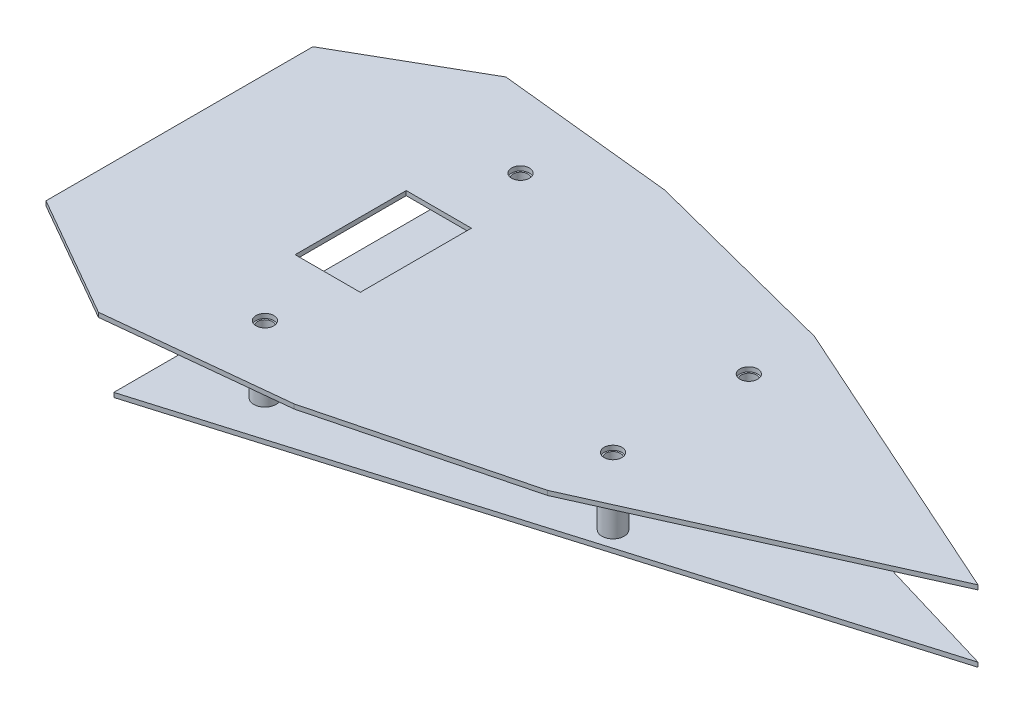
from build123d import *

# Parameters (mm, degrees)
STOCK_BODY2_2_1_START         = -47.04864598
STOCK_BODY2_2_1_OUTLINE_W     = 43.787012176
STOCK_BODY2_2_1_OUTLINE_H     = 74.629705784
STOCK_BODY2_2_1_OUTLINE_R     = 6
STOCK_BODY2_2_1_DEPTH         = 3
STOCK_BODY2_2_1_START_2       = -92.04864598
STOCK_BODY2_2_1_2_OUTLINE_R   = 6
STOCK_BODY2_2_1_2_OUTLINE_W   = 35.905709945
STOCK_BODY2_2_1_2_OUTLINE_H   = 59.945220798
STOCK_BODY2_2_1_2_DEPTH       = 3
STOCK_BODY2_2_1_START_3       = -89.04864598
STOCK_BODY2_2_1_3_OUTLINE_R   = 7.5
STOCK_BODY2_2_1_3_OUTLINE_R_2 = 5
STOCK_BODY2_2_1_3_DEPTH       = 42
SCALE1_SCALE                  = 1.5
SKETCH2_W                     = 19.240593306
SKETCH2_H                     = 84.91603611
BOSS_EXTRUDE1_DEPTH           = 38.1
SKETCH3_W                     = 30.633251364
SKETCH3_H                     = 84.659976372
BOSS_EXTRUDE2_DEPTH           = 38.1
SKETCH4_R                     = 19.304
CUT_EXTRUDE2_DEPTH            = 31.6738
SKETCH5_R                     = 24.765
CUT_EXTRUDE3_DEPTH            = 31.6738


# Read off the part's stored shape, not the designer's step: Stock-Body2.2-1
with BuildPart() as part:
    # Stock-Body2.2-1 outline → Stock-Body2.2-1 (new body)
    with BuildSketch(Plane(origin=(0, 0, 0), x_dir=(1, 0, 0), z_dir=(0, 1, 0)).offset(STOCK_BODY2_2_1_START)):
        Polygon((135.362738013, -89.648548647), (334.939803936, 0), (135.362738013, 89.648548647), (0, 124.445224737), (-119.088720056, 136.857824586), (-201.515305017, 89.648548647), (-201.515305017, -89.648548647), (-119.088720056, -136.857824586), (0, -124.445224737), align=None)
        with Locations((-64.591790786, 0)):
            Rectangle(STOCK_BODY2_2_1_OUTLINE_W, STOCK_BODY2_2_1_OUTLINE_H, mode=Mode.SUBTRACT)
        with Locations((-58.24622251, -85.855051723)):
            Circle(STOCK_BODY2_2_1_OUTLINE_R, mode=Mode.SUBTRACT)
        with Locations((135.362738013, -45.618949287)):
            Circle(STOCK_BODY2_2_1_OUTLINE_R, mode=Mode.SUBTRACT)
        with Locations((-58.24622251, 85.855051723)):
            Circle(STOCK_BODY2_2_1_OUTLINE_R, mode=Mode.SUBTRACT)
        with Locations((135.362738013, 45.618949287)):
            Circle(STOCK_BODY2_2_1_OUTLINE_R, mode=Mode.SUBTRACT)
    extrude(amount=STOCK_BODY2_2_1_DEPTH)



with BuildPart() as body_2:
    # Stock-Body2.2-1 2 outline → Stock-Body2.2-1 2 (new body)
    with BuildSketch(Plane(origin=(0, 0, 0), x_dir=(1, 0, 0), z_dir=(0, 1, 0)).offset(STOCK_BODY2_2_1_START_2)):
        Polygon((-112.290148162, -133.312365233), (334.939803936, 0), (-112.290148162, 133.312365233), align=None)
        with Locations((-58.24622251, -85.855051723)):
            Circle(STOCK_BODY2_2_1_2_OUTLINE_R, mode=Mode.SUBTRACT)
        with Locations((135.362738013, -45.618949287)):
            Circle(STOCK_BODY2_2_1_2_OUTLINE_R, mode=Mode.SUBTRACT)
        with Locations((-67.509316896, 0)):
            Rectangle(STOCK_BODY2_2_1_2_OUTLINE_W, STOCK_BODY2_2_1_2_OUTLINE_H, mode=Mode.SUBTRACT)
        with Locations((-58.24622251, 85.855051723)):
            Circle(STOCK_BODY2_2_1_2_OUTLINE_R, mode=Mode.SUBTRACT)
        with Locations((135.362738013, 45.618949287)):
            Circle(STOCK_BODY2_2_1_2_OUTLINE_R, mode=Mode.SUBTRACT)
    extrude(amount=STOCK_BODY2_2_1_2_DEPTH)


with BuildPart() as part_1:
    add(part.part)

    add(body_2.part)  # Stock-Body2.2-1 3 merges body 2
    # Stock-Body2.2-1 3 outline → Stock-Body2.2-1 3 (add)
    # profile 1 of 4: a face of its own
    with BuildSketch(Plane(origin=(0, 0, 0), x_dir=(1, 0, 0), z_dir=(0, 1, 0)).offset(STOCK_BODY2_2_1_START_3)):
        with Locations((135.362738013, -45.618949287)):
            Circle(STOCK_BODY2_2_1_3_OUTLINE_R)
        with Locations((135.362738013, -45.618949287)):
            Circle(STOCK_BODY2_2_1_3_OUTLINE_R_2, mode=Mode.SUBTRACT)
    # profile 2 of 4: a face of its own
    with BuildSketch(Plane(origin=(0, 0, 0), x_dir=(1, 0, 0), z_dir=(0, 1, 0)).offset(STOCK_BODY2_2_1_START_3)):
        with Locations((-58.24622251, 85.855051723)):
            Circle(STOCK_BODY2_2_1_3_OUTLINE_R)
        with Locations((-58.24622251, 85.855051723)):
            Circle(STOCK_BODY2_2_1_3_OUTLINE_R_2, mode=Mode.SUBTRACT)
    # profile 3 of 4: a face of its own
    with BuildSketch(Plane(origin=(0, 0, 0), x_dir=(1, 0, 0), z_dir=(0, 1, 0)).offset(STOCK_BODY2_2_1_START_3)):
        with Locations((135.362738013, 45.618949287)):
            Circle(STOCK_BODY2_2_1_3_OUTLINE_R)
        with Locations((135.362738013, 45.618949287)):
            Circle(STOCK_BODY2_2_1_3_OUTLINE_R_2, mode=Mode.SUBTRACT)
    # profile 4 of 4: a face of its own
    with BuildSketch(Plane(origin=(0, 0, 0), x_dir=(1, 0, 0), z_dir=(0, 1, 0)).offset(STOCK_BODY2_2_1_START_3)):
        with Locations((-58.24622251, -85.855051723)):
            Circle(STOCK_BODY2_2_1_3_OUTLINE_R)
        with Locations((-58.24622251, -85.855051723)):
            Circle(STOCK_BODY2_2_1_3_OUTLINE_R_2, mode=Mode.SUBTRACT)
    extrude(amount=STOCK_BODY2_2_1_3_DEPTH)


with BuildPart() as part_2:
    # Scale1: scaled about (21.693705028, -62.849152598, 0)
    add(part_1.part.scale(SCALE1_SCALE).moved(Location((-10.846852514, 31.424576299, 0))))

    # Sketch2 → Boss-Extrude1 (add)
    with BuildSketch(Plane.XZ.offset(106.648392671)):
        with Locations((-156.897972987, 0)):
            Rectangle(SKETCH2_W, SKETCH2_H)
    extrude(amount=BOSS_EXTRUDE1_DEPTH)

    # Sketch3 → Boss-Extrude2 (add)
    with BuildSketch(Plane.XZ.offset(106.648392671)):
        with Locations((-50.580967258, 0)):
            Rectangle(SKETCH3_W, SKETCH3_H)
    extrude(amount=BOSS_EXTRUDE2_DEPTH)

    # Sketch4 → Cut-Extrude2 (cut)
    with BuildSketch(Plane(origin=(-35.264341576, 0, 0), x_dir=(0, 0, -1), z_dir=(1, 0, 0))):
        with Locations((0, -144.748392671)):
            Circle(SKETCH4_R)
    extrude(amount=-CUT_EXTRUDE2_DEPTH, mode=Mode.SUBTRACT)

    # Sketch5 → Cut-Extrude3 (cut)
    with BuildSketch(Plane.ZY.offset(166.51826964)):
        with Locations((0, -144.748392671)):
            Circle(SKETCH5_R)
    extrude(amount=-CUT_EXTRUDE3_DEPTH, mode=Mode.SUBTRACT)


solid = part_2.part
